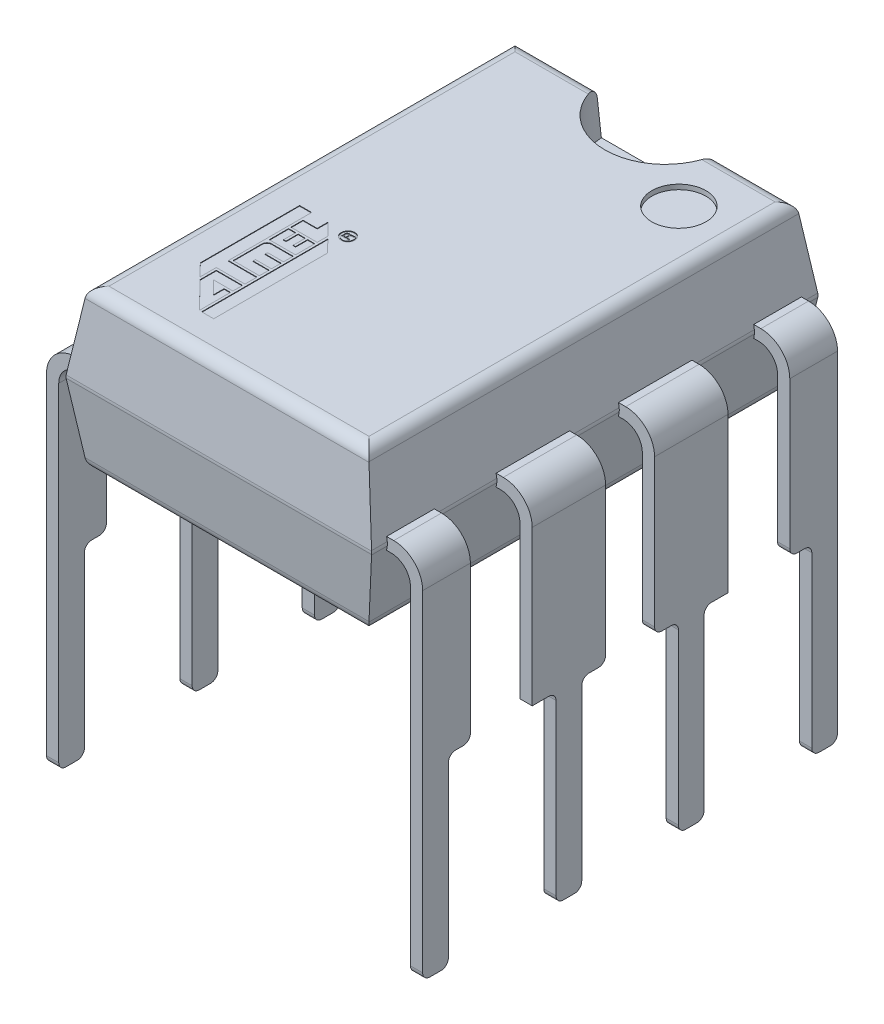
from build123d import *

# Parameters (mm, degrees)
RESSALTO_EXTRUS_O1_DEPTH = 4.6355
CORTE_EXTRUS_O1_DEPTH    = 6.85442242
RESSALTO_EXTRUS_O2_DEPTH = 0.762
RESSALTO_EXTRUS_O3_DEPTH = 0.4953
CORTE_EXTRUS_O3_DEPTH    = 10.637798579
CORTE_EXTRUS_O4_DEPTH    = 0.9906
CORTE_EXTRUS_O5_DEPTH    = 0.01
CORTE_EXTRUS_O6_DEPTH    = 0.01
ESBO_O10_R               = 0.561420923
CORTE_EXTRUS_O7_DEPTH    = 0.1


with BuildPart() as part:
    # Esboço1 → Ressalto-extrusão1 (new, symmetric)
    with BuildSketch(Plane.XY):
        with BuildLine():
            Line((3.168729295, 0.039346392), (2.945449428, 1.440346392))
            ThreePointArc((2.945449428, 1.440346392), (2.860835576, 1.591179649), (2.69856512, 1.651))
            Line((2.69856512, 1.651), (-2.69856512, 1.651))
            ThreePointArc((-2.69856512, 1.651), (-2.860835576, 1.591179649), (-2.945449428, 1.440346392))
            Line((-2.945449428, 1.440346392), (-3.168729295, 0.039346392))
            ThreePointArc((-3.168729295, 0.039346392), (-3.171844988, 0), (-3.168729295, -0.039346392))
            Line((-3.168729295, -0.039346392), (-2.945449428, -1.440346392))
            ThreePointArc((-2.945449428, -1.440346392), (-2.860835576, -1.591179649), (-2.69856512, -1.651))
            Line((-2.69856512, -1.651), (2.69856512, -1.651))
            ThreePointArc((2.69856512, -1.651), (2.860835576, -1.591179649), (2.945449428, -1.440346392))
            Line((2.945449428, -1.440346392), (3.168729295, -0.039346392))
            ThreePointArc((3.168729295, -0.039346392), (3.171844988, 0), (3.168729295, 0.039346392))
        make_face()
    extrude(amount=RESSALTO_EXTRUS_O1_DEPTH, both=True)

    # Esboço2 → Corte-extrusão1 (cut, symmetric)
    with BuildSketch(Plane(origin=(0, 0, 0), x_dir=(0, 0, -1), z_dir=(1, 0, 0))):
        with BuildLine():
            ThreePointArc((4.631857979, 0.030064884), (4.633672357, 0), (4.631857979, -0.030064884))
            Line((4.631857979, -0.030064884), (4.462142655, -1.431064884))
            ThreePointArc((4.462142655, -1.431064884), (4.379763817, -1.588104544), (4.213957033, -1.651))
            Line((4.213957033, -1.651), (5.097724036, -1.651))
            Line((5.097724036, -1.651), (5.097724036, 1.651))
            Line((5.097724036, 1.651), (4.213957033, 1.651))
            ThreePointArc((4.213957033, 1.651), (4.379763817, 1.588104544), (4.462142655, 1.431064884))
            Line((4.462142655, 1.431064884), (4.631857979, 0.030064884))
        make_face()
    corte_extrus_o1 = extrude(amount=CORTE_EXTRUS_O1_DEPTH, both=True, mode=Mode.SUBTRACT)

    # Espelhar1: Corte-extrusão1 across plane
    add(corte_extrus_o1.mirror(Plane.XY), mode=Mode.SUBTRACT)

    # Esboço3 → Ressalto-extrusão2 (add, symmetric)
    with BuildSketch(Plane.XY.offset(1.27)):
        with BuildLine():
            Line((-3.904, -7.495), (-3.904, -0.475))
            ThreePointArc((-3.904, -0.475), (-3.728264069, -0.050735931), (-3.304, 0.125))
            Line((-3.304, 0.125), (3.304, 0.125))
            ThreePointArc((3.304, 0.125), (3.728264069, -0.050735931), (3.904, -0.475))
            Line((3.904, -0.475), (3.904, -7.495))
            Line((3.904, -7.495), (3.65, -7.495))
            Line((3.65, -7.495), (3.65, -0.525))
            ThreePointArc((3.65, -0.525), (3.532842712, -0.242157288), (3.25, -0.125))
            Line((3.25, -0.125), (-3.25, -0.125))
            ThreePointArc((-3.25, -0.125), (-3.532842712, -0.242157288), (-3.65, -0.525))
            Line((-3.65, -0.525), (-3.65, -7.495))
            Line((-3.65, -7.495), (-3.904, -7.495))
        make_face()
    ressalto_extrus_o2 = extrude(amount=RESSALTO_EXTRUS_O2_DEPTH, both=True)

    # Esboço4 → Ressalto-extrusão3 (add, symmetric)
    with BuildSketch(Plane.XY.offset(3.81)):
        with BuildLine():
            Line((3.168729295, -0.039346392), (3.155078527, -0.125))
            Line((3.155078527, -0.125), (3.25, -0.125))
            ThreePointArc((3.25, -0.125), (3.532842712, -0.242157288), (3.65, -0.525))
            Line((3.65, -0.525), (3.65, -7.495))
            Line((3.65, -7.495), (3.904, -7.495))
            Line((3.904, -7.495), (3.904, -0.475))
            ThreePointArc((3.904, -0.475), (3.728264069, -0.050735931), (3.304, 0.125))
            Line((3.304, 0.125), (3.155078527, 0.125))
            Line((3.155078527, 0.125), (3.168729295, 0.039346392))
            ThreePointArc((3.168729295, 0.039346392), (3.171844988, 0), (3.168729295, -0.039346392))
        make_face()
        with BuildLine():
            Line((-3.168729295, 0.039346392), (-3.155078527, 0.125))
            Line((-3.155078527, 0.125), (-3.304, 0.125))
            ThreePointArc((-3.304, 0.125), (-3.728264069, -0.050735931), (-3.904, -0.475))
            Line((-3.904, -0.475), (-3.904, -7.495))
            Line((-3.904, -7.495), (-3.65, -7.495))
            Line((-3.65, -7.495), (-3.65, -0.525))
            ThreePointArc((-3.65, -0.525), (-3.532842712, -0.242157288), (-3.25, -0.125))
            Line((-3.25, -0.125), (-3.155078527, -0.125))
            Line((-3.155078527, -0.125), (-3.168729295, -0.039346392))
            ThreePointArc((-3.168729295, -0.039346392), (-3.171844988, 0), (-3.168729295, 0.039346392))
        make_face()
    ressalto_extrus_o3 = extrude(amount=RESSALTO_EXTRUS_O3_DEPTH, both=True)

    # Espelhar2: Ressalto-extrusão2, Ressalto-extrusão3 across plane
    add(ressalto_extrus_o2.mirror(Plane.XY))
    add(ressalto_extrus_o3.mirror(Plane.XY))

    # Esboço5 → Corte-extrusão3 (cut, symmetric)
    with BuildSketch(Plane(origin=(0, 0, 0), x_dir=(0, 0, -1), z_dir=(1, 0, 0))):
        with BuildLine():
            Line((2.032, -3.683), (1.6867, -3.683))
            ThreePointArc((1.6867, -3.683), (1.580633983, -3.726933983), (1.5367, -3.833))
            Line((1.5367, -3.833), (1.5367, -7.345))
            ThreePointArc((1.5367, -7.345), (1.492766017, -7.451066017), (1.3867, -7.495))
            Line((1.3867, -7.495), (1.1533, -7.495))
            ThreePointArc((1.1533, -7.495), (1.047233983, -7.451066017), (1.0033, -7.345))
            Line((1.0033, -7.345), (1.0033, -3.833))
            ThreePointArc((1.0033, -3.833), (0.959366017, -3.726933983), (0.8533, -3.683))
            Line((0.8533, -3.683), (0.658, -3.683))
            ThreePointArc((0.658, -3.683), (0.551933983, -3.639066017), (0.508, -3.533))
            Line((0.508, -3.533), (0.508, -2.784397714))
            Line((0.508, -2.784397714), (-0.179614472, -2.784397714))
            Line((-0.179614472, -2.784397714), (-0.179614472, -7.844264121))
            Line((-0.179614472, -7.844264121), (0.508, -7.759399457))
            Line((0.508, -7.759399457), (2.032, -7.759399457))
            Line((2.032, -7.759399457), (2.032, -3.683))
        make_face()
        with BuildLine():
            Line((3.6219, -3.683), (3.4647, -3.683))
            ThreePointArc((3.4647, -3.683), (3.358633983, -3.639066017), (3.3147, -3.533))
            Line((3.3147, -3.533), (3.3147, -7.972893341))
            Line((3.3147, -7.972893341), (4.3053, -7.972893341))
            Line((4.3053, -7.972893341), (4.816082601, -7.201156681))
            Line((4.816082601, -7.201156681), (4.3053, -7.201156681))
            Line((4.3053, -7.201156681), (4.3053, -7.345))
            ThreePointArc((4.3053, -7.345), (4.261366017, -7.451066017), (4.1553, -7.495))
            Line((4.1553, -7.495), (3.9219, -7.495))
            ThreePointArc((3.9219, -7.495), (3.815833983, -7.451066017), (3.7719, -7.345))
            Line((3.7719, -7.345), (3.7719, -3.833))
            ThreePointArc((3.7719, -3.833), (3.727966017, -3.726933983), (3.6219, -3.683))
        make_face()
    corte_extrus_o3 = extrude(amount=CORTE_EXTRUS_O3_DEPTH, both=True, mode=Mode.SUBTRACT)

    # Espelhar3: Corte-extrusão3 across plane
    add(corte_extrus_o3.mirror(Plane.XY), mode=Mode.SUBTRACT)

    # Esboço7 → Corte-extrusão4 (cut)
    with BuildSketch(Plane(origin=(0, 1.651, 0), x_dir=(1, 0, 0), z_dir=(0, 1, 0))):
        with BuildLine():
            Line((1.25, 4.631857979), (-1.25, 4.631857979))
            ThreePointArc((-1.25, 4.631857979), (0, 3.381857979), (1.25, 4.631857979))
        make_face()
    extrude(amount=-CORTE_EXTRUS_O4_DEPTH, mode=Mode.SUBTRACT)

    # Esboço8 → Corte-extrusão5 (cut)
    with BuildSketch(Plane(origin=(0, 1.651, 0), x_dir=(1, 0, 0), z_dir=(0, 1, 0))):
        Polygon((-1.275733609, -3.712725995), (-1.025733609, -3.712725995), (-1.025733609, -1.350005631), (-1.275733609, -1.093559926), align=None)
        Polygon((-2.170008695, -2.846683116), (-1.920008695, -3.103128821), (-1.920008695, -2.764543786), (-1.325733609, -2.764543786), (-1.325733609, -2.514543786), (-1.920008695, -2.514543786), (-1.920008695, -0.78582508), (-2.170008695, -0.78582508), align=None)
        Polygon((-1.325733609, -1.264543786), (-1.325733609, -1.042270785), (-1.575733609, -0.78582508), (-1.575733609, -1.014543786), (-1.870008695, -1.014543786), (-1.870008695, -1.264543786), align=None)
        with BuildLine():
            Line((-1.870008695, -2.464543786), (-1.325733609, -2.464543786))
            Line((-1.325733609, -2.464543786), (-1.325733609, -2.264543786))
            Line((-1.325733609, -2.264543786), (-1.656029696, -2.264543786))
            Line((-1.656029696, -2.264543786), (-1.656029696, -2.214543786))
            Line((-1.656029696, -2.214543786), (-1.325733609, -2.214543786))
            Line((-1.325733609, -2.214543786), (-1.325733609, -2.014543786))
            Line((-1.325733609, -2.014543786), (-1.656029696, -2.014543786))
            Line((-1.656029696, -2.014543786), (-1.656029696, -1.984543786))
            ThreePointArc((-1.656029696, -1.984543786), (-1.650171832, -1.970401651), (-1.636029696, -1.964543786))
            Line((-1.636029696, -1.964543786), (-1.325733609, -1.964543786))
            Line((-1.325733609, -1.964543786), (-1.325733609, -1.764543786))
            Line((-1.325733609, -1.764543786), (-1.770008695, -1.764543786))
            ThreePointArc((-1.770008695, -1.764543786), (-1.840719373, -1.793833108), (-1.870008695, -1.864543786))
            Line((-1.870008695, -1.864543786), (-1.870008695, -2.464543786))
        make_face()
        Polygon((-1.721917, -1.314543786), (-1.870008695, -1.314543786), (-1.870008695, -1.714543786), (-1.325733609, -1.714543786), (-1.325733609, -1.314543786), (-1.473825304, -1.314543786), (-1.473825304, -1.564543786), (-1.523825304, -1.564543786), (-1.523825304, -1.314543786), (-1.671917, -1.314543786), (-1.671917, -1.564543786), (-1.721917, -1.564543786), align=None)
        Polygon((-1.870008695, -3.150716656), (-1.325733609, -3.709024689), (-1.325733609, -3.064543786), (-1.458323577, -3.064543786), (-1.458323577, -3.286504021), (-1.723448152, -3.014543786), (-1.325733609, -3.014543786), (-1.325733609, -2.814543786), (-1.870008695, -2.814543786), align=None)
    extrude(amount=-CORTE_EXTRUS_O5_DEPTH, mode=Mode.SUBTRACT)

    # Esboço9 → Corte-extrusão6 (cut)
    # profile 1 of 2: a face of its own
    with BuildSketch(Plane(origin=(0, 1.651, 0), x_dir=(1, 0, 0), z_dir=(0, 1, 0))):
        with BuildLine():
            add(Edge.make_bspline(
                [(-1.113316931, -0.698119382), (-1.110223632, -0.698190206), (-1.104061139, -0.698331302), (-1.094899919, -0.699166237), (-1.085910056, -0.700673136), (-1.077105298, -0.70272785), (-1.068472111, -0.705408518), (-1.059999319, -0.708624335), (-1.051703135, -0.71246736), (-1.043612176, -0.716856233), (-1.035805563, -0.721761353), (-1.028370028, -0.727124922), (-1.021338353, -0.732910586), (-1.014770719, -0.739182559), (-1.008602012, -0.745869273), (-1.002880886, -0.753010121), (-0.997485107, -0.76052402), (-0.992671476, -0.768518398), (-0.988262128, -0.776745343), (-0.984453353, -0.785179572), (-0.981191495, -0.793757103), (-0.978533451, -0.802483889), (-0.976550451, -0.811369257), (-0.975017931, -0.820367208), (-0.974189257, -0.829529757), (-0.974047317, -0.835692071), (-0.973976069, -0.83878528)],
                knots=[0, 0, 0, 0, 1.01293954, 2.017985579, 3.008948542, 3.995376028, 4.976138791, 5.966696438, 6.960609832, 7.96753535, 8.978689331, 9.977322037, 10.967609382, 11.957812242, 12.94855568, 13.944151108, 14.952189352, 15.97505733, 16.997270778, 18.006967526, 19.00293262, 20.000291131, 20.991051458, 21.982014421, 22.98706046, 24, 24, 24, 24], degree=3))
            add(Edge.make_bspline(
                [(-0.973976069, -0.83878528), (-0.974047057, -0.841878527), (-0.974188479, -0.848040914), (-0.975022576, -0.857220295), (-0.976545593, -0.866237222), (-0.978524082, -0.875124961), (-0.981209764, -0.88384291), (-0.984452091, -0.892417911), (-0.988198995, -0.900890642), (-0.992618873, -0.909105849), (-0.997438819, -0.917082036), (-1.002768496, -0.924630584), (-1.008499884, -0.931751297), (-1.014661883, -0.938443869), (-1.021247993, -0.94471228), (-1.02826247, -0.950550605), (-1.035684648, -0.955971237), (-1.043506077, -0.960874685), (-1.051610123, -0.965251942), (-1.059866713, -0.969157384), (-1.068327762, -0.972383394), (-1.076915251, -0.975037076), (-1.085643587, -0.977112258), (-1.094511352, -0.978611454), (-1.103530698, -0.979452119), (-1.109587538, -0.979592645), (-1.112627912, -0.979663185)],
                knots=[0, 0, 0, 0, 1.015194179, 2.022477288, 3.021366155, 4.014331753, 5.008363102, 6.011968763, 7.021535151, 8.04602388, 9.071168596, 10.078101256, 11.075912718, 12.068861391, 13.061268282, 14.057461452, 15.061720006, 16.075124653, 17.084291424, 18.082860558, 19.070207841, 20.053153623, 21.030492275, 22.012223329, 23.002188538, 24, 24, 24, 24], degree=3))
            add(Edge.make_bspline(
                [(-1.112627912, -0.979663185), (-1.115703692, -0.979593446), (-1.12181362, -0.979454912), (-1.130919878, -0.978605827), (-1.139860881, -0.977120697), (-1.148672584, -0.975026525), (-1.15733793, -0.972396323), (-1.165877751, -0.969145322), (-1.174226911, -0.965252299), (-1.182429072, -0.960890707), (-1.190320011, -0.955956919), (-1.197814636, -0.95056168), (-1.204924025, -0.944786054), (-1.211489519, -0.938474482), (-1.217712814, -0.931823833), (-1.22344185, -0.924682718), (-1.228749679, -0.917140434), (-1.233622425, -0.909221061), (-1.237930171, -0.900965519), (-1.241769247, -0.892562931), (-1.244972234, -0.883971053), (-1.247533233, -0.875228046), (-1.249664944, -0.866342531), (-1.251028963, -0.857279182), (-1.252009427, -0.848082011), (-1.25208816, -0.841897375), (-1.252127779, -0.83878528)],
                knots=[0, 0, 0, 0, 1.005458181, 1.997307363, 2.986597713, 3.965739142, 4.955888785, 5.944774503, 6.949917516, 7.965310871, 8.979652618, 9.989347671, 10.982423423, 11.970954953, 12.963946742, 13.957861738, 14.960862312, 15.977076479, 16.99486475, 18.002857264, 18.99510987, 19.989125527, 20.979510924, 21.979280893, 22.983178859, 24, 24, 24, 24], degree=3))
            add(Edge.make_bspline(
                [(-1.252127779, -0.83878528), (-1.252087437, -0.835673332), (-1.252007267, -0.829488986), (-1.251039289, -0.820307037), (-1.249639719, -0.81127277), (-1.247611158, -0.802403234), (-1.245023688, -0.79370417), (-1.241808693, -0.785180596), (-1.238054588, -0.776798899), (-1.233697526, -0.768624946), (-1.228937089, -0.760683407), (-1.223579232, -0.753202746), (-1.217888363, -0.74608456), (-1.211683337, -0.739431275), (-1.205085377, -0.733171037), (-1.197980436, -0.727396048), (-1.190528064, -0.721964451), (-1.182624571, -0.717063187), (-1.17446731, -0.712635035), (-1.166117258, -0.708746978), (-1.15764462, -0.705443135), (-1.149004481, -0.702809858), (-1.140272902, -0.700659147), (-1.131396769, -0.699179233), (-1.122396987, -0.698326991), (-1.116357449, -0.698188901), (-1.113316931, -0.698119382)],
                knots=[0, 0, 0, 0, 1.020718287, 2.028463869, 3.026339786, 4.019218694, 5.011488143, 6.002113567, 7.00630118, 8.02286241, 9.039952462, 10.042062951, 11.039787301, 12.028392095, 13.02491994, 14.021801831, 15.030663991, 16.048893381, 17.070927834, 18.074663535, 19.069419264, 20.052279231, 21.036523064, 22.018168409, 23.002275651, 24, 24, 24, 24], degree=3))
        make_face()
        with BuildLine():
            add(Edge.make_bspline(
                [(-1.113051924, -0.718471946), (-1.115650476, -0.718528176), (-1.120840243, -0.718640477), (-1.128565274, -0.719382027), (-1.136154477, -0.720673872), (-1.143643795, -0.722403103), (-1.150965372, -0.72477302), (-1.15822655, -0.727512994), (-1.165338967, -0.730821262), (-1.172296031, -0.734611736), (-1.178993789, -0.738864983), (-1.185448597, -0.743380972), (-1.191421035, -0.748401779), (-1.197068945, -0.753725069), (-1.202388691, -0.759372466), (-1.207239138, -0.76546625), (-1.2118595, -0.771813281), (-1.215928588, -0.778589031), (-1.219655417, -0.785564926), (-1.222874113, -0.792725708), (-1.225668049, -0.80000232), (-1.227875951, -0.807452219), (-1.229645938, -0.815022942), (-1.2308412, -0.822731482), (-1.231616029, -0.830554257), (-1.231721866, -0.835815357), (-1.231775215, -0.838467272)],
                knots=[0, 0, 0, 0, 0.998510433, 1.99420145, 2.978557459, 3.955016305, 4.944788344, 5.93323247, 6.935566421, 7.956306733, 8.975262078, 9.983029768, 10.980870734, 11.970153749, 12.964385708, 13.958872577, 14.961114567, 15.978689504, 16.992998323, 17.998683113, 18.993471156, 19.985731143, 20.982023689, 21.978686224, 22.981135116, 24, 24, 24, 24], degree=3))
            add(Edge.make_bspline(
                [(-1.231775215, -0.838467272), (-1.231721993, -0.841136872), (-1.231616402, -0.846433274), (-1.230839654, -0.854308496), (-1.229654374, -0.862054581), (-1.227859259, -0.869671934), (-1.225670196, -0.877196376), (-1.222875101, -0.884579227), (-1.219653209, -0.891843395), (-1.21594836, -0.898921439), (-1.211824404, -0.905766712), (-1.207275335, -0.912252349), (-1.202385307, -0.918406376), (-1.197068925, -0.924108183), (-1.191437427, -0.929486618), (-1.185447213, -0.934506507), (-1.178992133, -0.939020146), (-1.17231126, -0.943287366), (-1.165323338, -0.94700326), (-1.158214107, -0.950333574), (-1.150921092, -0.95307601), (-1.143527122, -0.955364265), (-1.135996499, -0.957113171), (-1.128352647, -0.95839929), (-1.120557631, -0.959144204), (-1.115314841, -0.959254972), (-1.112680914, -0.959310621)],
                knots=[0, 0, 0, 0, 1.019324427, 2.022307635, 3.019487612, 4.009635833, 5.008708405, 6.009988272, 7.021782629, 8.04177668, 9.058843464, 10.071424816, 11.065037872, 12.058078115, 13.045902014, 14.037589107, 15.039141703, 16.051812958, 17.0630448, 18.059197169, 19.047850166, 20.035950508, 21.012955405, 21.997895073, 22.994161673, 24, 24, 24, 24], degree=3))
            add(Edge.make_bspline(
                [(-1.112680914, -0.959310621), (-1.110064654, -0.959254939), (-1.104857129, -0.959144107), (-1.097114803, -0.958399718), (-1.089524473, -0.957111611), (-1.082060934, -0.955373665), (-1.074744, -0.953064724), (-1.067517788, -0.950334392), (-1.060461477, -0.947003241), (-1.053529105, -0.943283731), (-1.046902218, -0.939039593), (-1.040541095, -0.934470905), (-1.034544159, -0.929487709), (-1.028943746, -0.92408893), (-1.023721172, -0.918318945), (-1.018825087, -0.912202776), (-1.014266397, -0.905703782), (-1.01015335, -0.898815238), (-1.006477412, -0.891706987), (-1.003214015, -0.884462208), (-1.000436233, -0.877089257), (-0.998243258, -0.869566327), (-0.996456224, -0.861965104), (-0.99525908, -0.854238656), (-0.994490136, -0.846397726), (-0.994382638, -0.841119135), (-0.994328633, -0.838467272)],
                knots=[0, 0, 0, 0, 1.002724266, 1.995868913, 2.97770754, 3.9516692, 4.930420864, 5.916337153, 6.909966435, 7.918912988, 8.929539567, 9.923722429, 10.919011527, 11.91510648, 12.902602689, 13.899824746, 14.916083996, 15.942645367, 16.972350747, 17.981638072, 18.986554787, 19.98925619, 20.983000827, 21.977114508, 22.983740751, 24, 24, 24, 24], degree=3))
            add(Edge.make_bspline(
                [(-0.994328633, -0.838467272), (-0.994382493, -0.83583306), (-0.994489699, -0.830589705), (-0.995262473, -0.822784336), (-0.996455831, -0.815093516), (-0.998218534, -0.807531588), (-1.000515363, -0.800105082), (-1.003265265, -0.792789876), (-1.006513935, -0.785597795), (-1.010256035, -0.778589321), (-1.014456569, -0.771838915), (-1.018915202, -0.765328375), (-1.02388963, -0.759324658), (-1.029098739, -0.753582933), (-1.03469805, -0.748253267), (-1.040686111, -0.743306524), (-1.046972947, -0.738672622), (-1.053645643, -0.734527669), (-1.060521004, -0.730759603), (-1.067573129, -0.727452723), (-1.074810877, -0.724706649), (-1.082168046, -0.722410339), (-1.089683642, -0.720670504), (-1.097327107, -0.719383005), (-1.105139823, -0.718636639), (-1.110400316, -0.71852714), (-1.113051924, -0.718471946)],
                knots=[0, 0, 0, 0, 1.01184181, 2.014054762, 3.010482721, 3.999928697, 4.993926651, 5.994828814, 7.000276903, 8.023526739, 9.044410415, 10.05358549, 11.05211467, 12.036894083, 13.030613943, 14.018662265, 15.019150138, 16.028507778, 17.033841324, 18.029783756, 19.017995239, 20.005507268, 20.988343552, 21.979161966, 22.981374919, 24, 24, 24, 24], degree=3))
        make_face(mode=Mode.SUBTRACT)
    # profile 2 of 2: a face of its own
    with BuildSketch(Plane(origin=(0, 1.651, 0), x_dir=(1, 0, 0), z_dir=(0, 1, 0))):
        with BuildLine():
            Line((-1.191070086, -0.898252929), (-1.191070086, -0.832319101))
            add(Edge.make_bspline(
                [(-1.191070086, -0.832319101), (-1.191064601, -0.830463836), (-1.191053992, -0.826875626), (-1.1908412, -0.821695926), (-1.190483078, -0.816921079), (-1.189951079, -0.812572759), (-1.189306097, -0.80863263), (-1.188618992, -0.805070138), (-1.187633383, -0.801933256), (-1.186251752, -0.798258229), (-1.183997617, -0.794132314), (-1.180528086, -0.789746999), (-1.176429344, -0.785768717), (-1.171571466, -0.782413254), (-1.166199132, -0.779588717), (-1.160306621, -0.777559925), (-1.153979662, -0.776393634), (-1.149627776, -0.776224333), (-1.147396876, -0.776137544)],
                knots=[0, 0, 0, 0, 1.090133396, 2.10839223, 3.045571793, 3.90318243, 4.681467695, 5.392068096, 6.032463167, 6.610867459, 7.697931585, 8.777833424, 9.886544268, 11.041534591, 12.234894292, 13.443109013, 14.689265264, 16, 16, 16, 16], degree=3))
            add(Edge.make_bspline(
                [(-1.147396876, -0.776137544), (-1.145469555, -0.776160255), (-1.141765903, -0.776203898), (-1.136416964, -0.776754202), (-1.131472986, -0.777603974), (-1.128379472, -0.778545073), (-1.126885308, -0.778999623)],
                knots=[0, 0, 0, 0, 1.111519694, 2.135960623, 3.099670721, 4, 4, 4, 4], degree=3))
            add(Edge.make_bspline(
                [(-1.126885308, -0.778999623), (-1.125764381, -0.779744521), (-1.123308823, -0.781376331), (-1.119874524, -0.784829648), (-1.116357617, -0.789318786), (-1.114103172, -0.792743545), (-1.11289292, -0.794582055)],
                knots=[0, 0, 0, 0, 0.763067721, 1.671614187, 2.750054546, 4, 4, 4, 4], degree=3))
            add(Edge.make_bspline(
                [(-1.11289292, -0.794582055), (-1.112038453, -0.792876362), (-1.110434112, -0.789673763), (-1.107465603, -0.785548595), (-1.104406228, -0.782225321), (-1.100907223, -0.779688146), (-1.096590919, -0.778028957), (-1.091279499, -0.776946912), (-1.084787353, -0.776198737), (-1.080052215, -0.776159041), (-1.077487938, -0.776137544)],
                knots=[0, 0, 0, 0, 1.05969687, 1.989679929, 2.81692925, 3.56411815, 4.370795319, 5.367504917, 6.574393456, 8, 8, 8, 8], degree=3))
            Line((-1.077487938, -0.776137544), (-1.059891451, -0.776137544))
            add(Edge.make_bspline(
                [(-1.059891451, -0.776137544), (-1.057885512, -0.776070485), (-1.054019965, -0.775941259), (-1.048510628, -0.774539096), (-1.043470143, -0.772410219), (-1.040597474, -0.77026295), (-1.039167876, -0.769194352)],
                knots=[0, 0, 0, 0, 1.077278145, 2.075970719, 3.042497546, 4, 4, 4, 4], degree=3))
            Line((-1.039167876, -0.769194352), (-1.035033762, -0.765961262))
            Line((-1.035033762, -0.765961262), (-1.035033762, -0.796490108))
            add(Edge.make_bspline(
                [(-1.035033762, -0.796490108), (-1.036532851, -0.796788325), (-1.039642322, -0.797406898), (-1.044548198, -0.798059234), (-1.049829, -0.798664492), (-1.053494535, -0.798908332), (-1.055386326, -0.799034179)],
                knots=[0, 0, 0, 0, 0.893269988, 1.852855729, 2.891853529, 4, 4, 4, 4], degree=3))
            Line((-1.055386326, -0.799034179), (-1.072346796, -0.799882202))
            add(Edge.make_bspline(
                [(-1.072346796, -0.799882202), (-1.073801152, -0.800004256), (-1.076483181, -0.800229341), (-1.080127737, -0.801065447), (-1.083151094, -0.801995857), (-1.085534753, -0.803352122), (-1.08733043, -0.805060538), (-1.088938445, -0.80691028), (-1.090097997, -0.809191423), (-1.091221465, -0.811832805), (-1.091934038, -0.815328657), (-1.092333818, -0.819925528), (-1.092662159, -0.82581336), (-1.092686155, -0.830180815), (-1.09269936, -0.832584108)],
                knots=[0, 0, 0, 0, 1.168942909, 2.155688804, 2.993656066, 3.698477469, 4.33044771, 4.974534503, 5.653083579, 6.371449627, 7.272128381, 8.497429772, 10.072629976, 12, 12, 12, 12], degree=3))
            Line((-1.09269936, -0.832584108), (-1.09269936, -0.87450827))
            Line((-1.09269936, -0.87450827), (-1.035033762, -0.87450827))
            Line((-1.035033762, -0.87450827), (-1.035033762, -0.898252929))
            Line((-1.035033762, -0.898252929), (-1.191070086, -0.898252929))
        make_face()
        with BuildLine():
            Line((-1.163933334, -0.87450827), (-1.119836112, -0.87450827))
            Line((-1.119836112, -0.87450827), (-1.119836112, -0.834280156))
            add(Edge.make_bspline(
                [(-1.119836112, -0.834280156), (-1.119853081, -0.83146697), (-1.119884106, -0.82632354), (-1.120659932, -0.819373335), (-1.121624198, -0.813789871), (-1.12300033, -0.810783728), (-1.123599216, -0.809475468)],
                knots=[0, 0, 0, 0, 1.33299016, 2.437144452, 3.319852202, 4, 4, 4, 4], degree=3))
            add(Edge.make_bspline(
                [(-1.123599216, -0.809475468), (-1.124578266, -0.808006499), (-1.126510762, -0.805106979), (-1.13088717, -0.80200108), (-1.136175925, -0.800143151), (-1.140012805, -0.79997252), (-1.142043728, -0.799882202)],
                knots=[0, 0, 0, 0, 0.962699712, 1.900222556, 2.888553698, 4, 4, 4, 4], degree=3))
            add(Edge.make_bspline(
                [(-1.142043728, -0.799882202), (-1.143819119, -0.799951306), (-1.147157601, -0.800081251), (-1.151829947, -0.801371064), (-1.15574846, -0.803568428), (-1.158376485, -0.806169487), (-1.15999145, -0.808728407), (-1.161055765, -0.811045051), (-1.161924201, -0.813737143), (-1.162677164, -0.816800077), (-1.163235642, -0.820239014), (-1.163672951, -0.824058388), (-1.163847209, -0.828254202), (-1.163903835, -0.831170721), (-1.163933334, -0.832690111)],
                knots=[0, 0, 0, 0, 1.402748615, 2.637756338, 3.796306401, 4.923463337, 5.520809349, 6.183924975, 6.935623081, 7.75633199, 8.678137703, 9.691095723, 10.797152986, 12, 12, 12, 12], degree=3))
            Line((-1.163933334, -0.832690111), (-1.163933334, -0.87450827))
        make_face(mode=Mode.SUBTRACT)
    extrude(amount=-CORTE_EXTRUS_O6_DEPTH, mode=Mode.SUBTRACT)

    # Esboço10 → Corte-extrusão7 (cut)
    with BuildSketch(Plane(origin=(0, 1.651, 0), x_dir=(1, 0, 0), z_dir=(0, 1, 0))):
        with Locations((1.778615951, 3.138167753)):
            Circle(ESBO_O10_R)
    extrude(amount=-CORTE_EXTRUS_O7_DEPTH, mode=Mode.SUBTRACT)


solid = part.part
